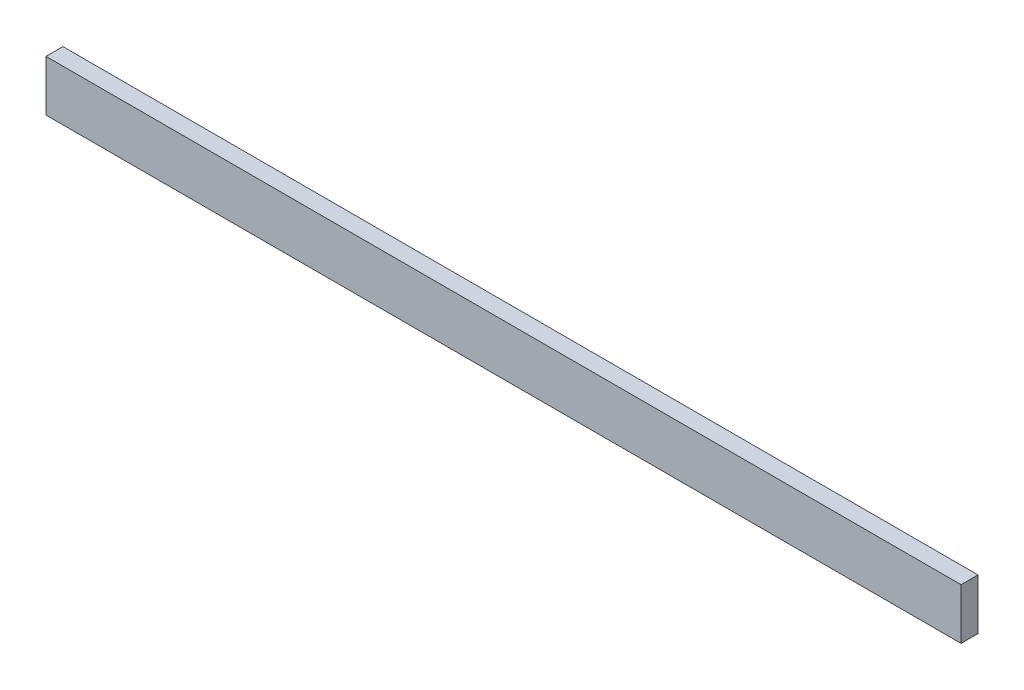
from build123d import *

# Parameters (mm, degrees)
SKETCH_1_W      = 54
SKETCH_1_H      = 3
EXTRUDE_1_DEPTH = 1


with BuildPart() as part:
    # 草图1 → 凸台-拉伸1 (new body)
    with BuildSketch(Plane.XY):
        Rectangle(SKETCH_1_W, SKETCH_1_H)
    extrude(amount=EXTRUDE_1_DEPTH)


solid = part.part
